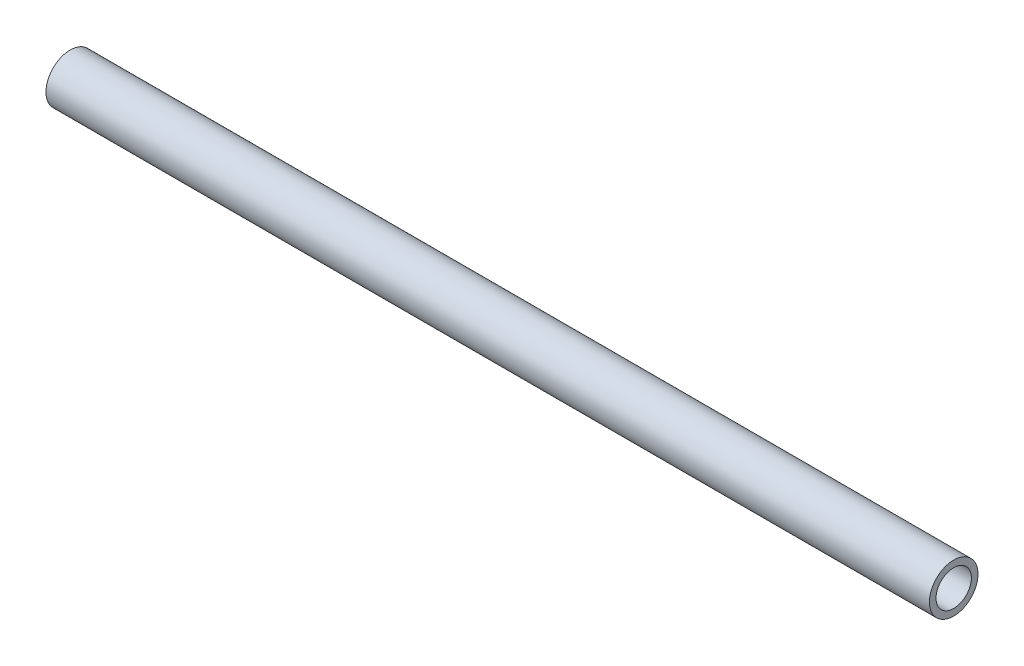
from build123d import *

# Parameters (mm, degrees)
SKETCH1_R           = 4.125
SKETCH1_R_2         = 3
BOSS_EXTRUDE1_DEPTH = 150


with BuildPart() as part:
    # Sketch1 → Boss-Extrude1 (new body)
    with BuildSketch(Plane(origin=(0, 0, 0), x_dir=(0, 0, -1), z_dir=(1, 0, 0))):
        Circle(SKETCH1_R)
        Circle(SKETCH1_R_2, mode=Mode.SUBTRACT)
    extrude(amount=BOSS_EXTRUDE1_DEPTH)


solid = part.part
